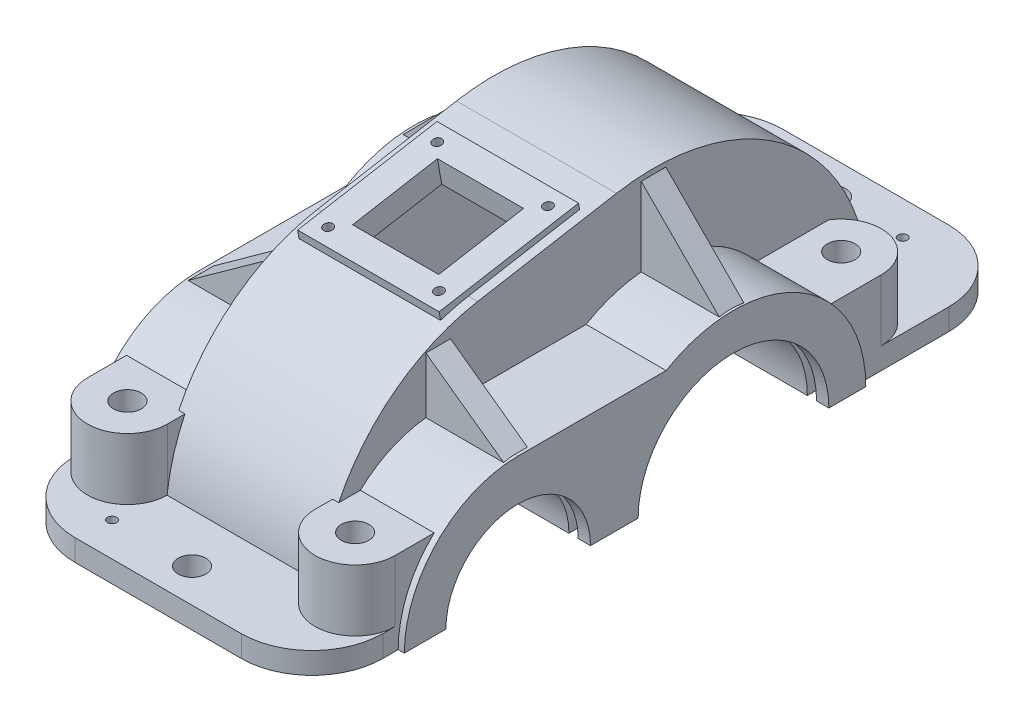
from build123d import *

# Parameters (mm, degrees)
EXTRUDE_1_DEPTH             = 7
EXTRUDE_2_DEPTH             = 52
EXTRUDE_4_DEPTH             = 26
SKETCH_4_R                  = 13
SKETCH_4_W                  = 26
SKETCH_4_H                  = 38
SKETCH_4_H_2                = 45
EXTRUDE_5_DEPTH             = 20
RIB_5_REACH                 = 188.625
SKETCH_5_WALL_W             = 406.05642967
SKETCH_5_WALL_H             = 8
RIB_6_REACH                 = 162.714
SKETCH_6_WALL_W             = 359.136664294
SKETCH_6_WALL_H             = 8
CUT_EXTRUDE_1_REACH         = 143.06
SKETCH_7_R                  = 4.5
CUT_EXTRUDE_2_REACH         = 135.334
SKETCH_8_R                  = 4.5
PATTERN_LINEAR_1_COUNT      = 2
PATTERN_LINEAR_1_PITCH      = 74
PATTERN_LINEAR_1_COUNT_DIR2 = 2
PATTERN_LINEAR_1_PITCH_DIR2 = 158
CUT_EXTRUDE_3_REACH         = 143.06
SKETCH_9_R                  = 1.5
CUT_EXTRUDE_4_REACH         = 143.06
SKETCH_10_R                 = 1.5
SKETCH_11_R                 = 23.5
SKETCH_11_R_2               = 31
CUT_EXTRUDE_5_DEPTH         = 285.5
CUT_EXTRUDE_START           = 48
SKETCH_13_R                 = 27.5
SKETCH_13_R_2               = 35
CUT_EXTRUDE_6_DEPTH         = 3
CUT_EXTRUDE_7_DEPTH         = 20
EXTRUDE_6_DEPTH             = 23
CUT_EXTRUDE_8_REACH         = 154.782
SKETCH_17_W                 = 28
SKETCH_17_H                 = 28
CUT_EXTRUDE_9_REACH         = 154.782
SKETCH_18_R                 = 1.5


with BuildPart() as part:
    # 草图1 → 凸台-拉伸1 (new body)
    with BuildSketch(Plane(origin=(0, 0, 0), x_dir=(1, 0, 0), z_dir=(0, 1, 0))):
        with BuildLine():
            Line((-27, 115), (27, 115))
            ThreePointArc((27, 115), (43.263455967, 108.263455967), (50, 92))
            Line((50, 92), (50, -92))
            ThreePointArc((50, -92), (43.263455967, -108.263455967), (27, -115))
            Line((27, -115), (-27, -115))
            ThreePointArc((-27, -115), (-43.263455967, -108.263455967), (-50, -92))
            Line((-50, -92), (-50, 92))
            ThreePointArc((-50, 92), (-43.263455967, 108.263455967), (-27, 115))
        make_face()
    extrude(amount=EXTRUDE_1_DEPTH)

    # 草图2 → 凸台-拉伸2 (add, symmetric)
    with BuildSketch(Plane(origin=(0, 0, 0), x_dir=(0, 0, -1), z_dir=(1, 0, 0))):
        with BuildLine():
            Line((-1.9089023, 37), (-50, 37))
            ThreePointArc((-50, 37), (-76.162950904, 26.162950904), (-87, 0))
            Line((-87, 0), (63, 0))
            ThreePointArc((63, 0), (41.294567395, 37.356945799), (-1.9089023, 37))
        make_face()
    extrude(amount=EXTRUDE_2_DEPTH, both=True)

    # 草图3 → 凸台-拉伸4 (add, symmetric)
    with BuildSketch(Plane(origin=(0, 0, 0), x_dir=(0, 0, -1), z_dir=(1, 0, 0))):
        with BuildLine():
            Line((7.956989247, 68.956260717), (-37.166666667, 61.075545206))
            ThreePointArc((-37.166666667, 61.075545206), (-71.630787409, 42.511316468), (-88.103571325, 7))
            Line((-88.103571325, 7), (89.649120597, 7))
            ThreePointArc((89.649120597, 7), (62.299651693, 55.774003502), (7.956989247, 68.956260717))
        make_face()
    extrude(amount=EXTRUDE_4_DEPTH, both=True)

    # 草图4 → 凸台-拉伸5 (add)
    with BuildSketch(Plane(origin=(0, 7, 0), x_dir=(1, 0, 0), z_dir=(0, 1, 0))):
        with Locations((37, -88)):
            Circle(SKETCH_4_R)
        with Locations((-37, -88)):
            Circle(SKETCH_4_R)
        with Locations((37, 70)):
            Circle(SKETCH_4_R)
        with Locations((-37, 70)):
            Circle(SKETCH_4_R)
        with Locations((37, -69)):
            Rectangle(SKETCH_4_W, SKETCH_4_H)
        with Locations((-37, -69)):
            Rectangle(SKETCH_4_W, SKETCH_4_H)
        with Locations((37, 47.5)):
            Rectangle(SKETCH_4_W, SKETCH_4_H_2)
        with Locations((-37, 47.5)):
            Rectangle(SKETCH_4_W, SKETCH_4_H_2)
    extrude(amount=EXTRUDE_5_DEPTH)

    # 草图5 wall → 筋5 (add, up to next)
    with BuildSketch(Plane(origin=(38.5, 46, 50), x_dir=(-0.811534341451, 0.584304725845, 0), z_dir=(-0.584304725845, -0.811534341451, 0)), mode=Mode.PRIVATE) as rib_5_sk1:
        Rectangle(SKETCH_5_WALL_W, SKETCH_5_WALL_H)
    rib_5_tool1 = extrude(rib_5_sk1.sketch, amount=RIB_5_REACH, mode=Mode.PRIVATE) - part.part
    rib_5 = rib_5_tool1.solids().sort_by_distance((38.5, 46, 50))[0]
    add(rib_5)

    # 镜向1: 筋5 across plane
    add(rib_5.mirror(Plane(origin=(0, 0, 0), x_dir=(0, 0, 1), z_dir=(1, 0, 0))))

    # 草图6 wall → 筋6 (add, up to next)
    with BuildSketch(Plane(origin=(38.590481041, 55.659219169, -20), x_dir=(-0.705179186997, 0.709029134963, 0), z_dir=(-0.709029134963, -0.705179186997, 0)), mode=Mode.PRIVATE) as rib_6_sk1:
        Rectangle(SKETCH_6_WALL_W, SKETCH_6_WALL_H)
    rib_6_tool1 = extrude(rib_6_sk1.sketch, amount=RIB_6_REACH, mode=Mode.PRIVATE) - part.part
    rib_6 = rib_6_tool1.solids().sort_by_distance((38.590481041, 55.659219169, -20))[0]
    add(rib_6)

    # 镜向2: 筋6 across plane
    add(rib_6.mirror(Plane(origin=(0, 0, 0), x_dir=(0, 0, 1), z_dir=(1, 0, 0))))

    # 草图7 → 切除-拉伸1 (cut, up to next)
    with BuildSketch(Plane(origin=(0, 7, 0), x_dir=(1, 0, 0), z_dir=(0, 1, 0)), mode=Mode.PRIVATE) as cut_extrude_1_sk1:
        with Locations((0, 104)):
            Circle(SKETCH_7_R)
    cut_extrude_1_tool1 = extrude(cut_extrude_1_sk1.sketch, amount=-CUT_EXTRUDE_1_REACH, mode=Mode.PRIVATE) & part.part
    # 草图7 → 切除-拉伸1 (cut, up to next)
    with BuildSketch(Plane(origin=(0, 7, 0), x_dir=(1, 0, 0), z_dir=(0, 1, 0)), mode=Mode.PRIVATE) as cut_extrude_1_sk2:
        with Locations((0, -104)):
            Circle(SKETCH_7_R)
    cut_extrude_1_tool2 = extrude(cut_extrude_1_sk2.sketch, amount=-CUT_EXTRUDE_1_REACH, mode=Mode.PRIVATE) & part.part
    add(cut_extrude_1_tool1.solids().sort_by_distance((0, 7, -104))[0], mode=Mode.SUBTRACT)
    add(cut_extrude_1_tool2.solids().sort_by_distance((0, 7, 104))[0], mode=Mode.SUBTRACT)

    # 草图8 → 切除-拉伸2 (cut, up to next)
    with BuildSketch(Plane(origin=(0, 27, 0), x_dir=(1, 0, 0), z_dir=(0, 1, 0)), mode=Mode.PRIVATE) as cut_extrude_2_sk1:
        with Locations((-37, 70)):
            Circle(SKETCH_8_R)
    cut_extrude_2_tool1 = extrude(cut_extrude_2_sk1.sketch, amount=-CUT_EXTRUDE_2_REACH, mode=Mode.PRIVATE) & part.part
    cut_extrude_2 = cut_extrude_2_tool1.solids().sort_by_distance((-37, 27, -70))[0]
    add(cut_extrude_2, mode=Mode.SUBTRACT)

    # 阵列(线性)1: Cut-Extrude 2 2 × 2
    with Locations(*[(i * PATTERN_LINEAR_1_PITCH, 0, j * PATTERN_LINEAR_1_PITCH_DIR2) for i in range(PATTERN_LINEAR_1_COUNT) for j in range(PATTERN_LINEAR_1_COUNT_DIR2) if (i, j) != (0, 0)]):
        add(cut_extrude_2, mode=Mode.SUBTRACT)

    # 草图9 → 切除-拉伸3 (cut, up to next)
    with BuildSketch(Plane(origin=(0, 7, 0), x_dir=(1, 0, 0), z_dir=(0, 1, 0)), mode=Mode.PRIVATE) as cut_extrude_3_sk1:
        with Locations((-26, -104)):
            Circle(SKETCH_9_R)
    cut_extrude_3_tool1 = extrude(cut_extrude_3_sk1.sketch, amount=-CUT_EXTRUDE_3_REACH, mode=Mode.PRIVATE) & part.part
    add(cut_extrude_3_tool1.solids().sort_by_distance((-26, 7, 104))[0], mode=Mode.SUBTRACT)

    # 草图10 → 切除-拉伸4 (cut, up to next)
    with BuildSketch(Plane(origin=(0, 7, 0), x_dir=(1, 0, 0), z_dir=(0, 1, 0)), mode=Mode.PRIVATE) as cut_extrude_4_sk1:
        with Locations((23, 104)):
            Circle(SKETCH_10_R)
    cut_extrude_4_tool1 = extrude(cut_extrude_4_sk1.sketch, amount=-CUT_EXTRUDE_4_REACH, mode=Mode.PRIVATE) & part.part
    add(cut_extrude_4_tool1.solids().sort_by_distance((23, 7, -104))[0], mode=Mode.SUBTRACT)

    # 草图11 → 切除-拉伸5 (cut, symmetric)
    with BuildSketch(Plane(origin=(0, 0, 0), x_dir=(0, 0, -1), z_dir=(1, 0, 0))):
        with Locations((-50, 0)):
            Circle(SKETCH_11_R)
        with Locations((20, 0)):
            Circle(SKETCH_11_R_2)
    extrude(amount=CUT_EXTRUDE_5_DEPTH, both=True, mode=Mode.SUBTRACT)

    # 草图13 → 切除-拉伸6 (cut)
    with BuildSketch(Plane(origin=(0, 0, 0), x_dir=(0, 0, -1), z_dir=(1, 0, 0)).offset(CUT_EXTRUDE_START)):
        with Locations((-50, 0)):
            Circle(SKETCH_13_R)
        with Locations((20, 0)):
            Circle(SKETCH_13_R_2)
    cut_extrude_6 = extrude(amount=-CUT_EXTRUDE_6_DEPTH, mode=Mode.SUBTRACT)

    # 镜向3: 切除-拉伸6 across plane
    add(cut_extrude_6.mirror(Plane(origin=(0, 0, 0), x_dir=(0, 0, 1), z_dir=(1, 0, 0))), mode=Mode.SUBTRACT)

    # 草图15 → 切除-拉伸7 (cut, symmetric)
    with BuildSketch(Plane(origin=(0, 0, 0), x_dir=(0, 0, -1), z_dir=(1, 0, 0))):
        with BuildLine():
            Line((-82.5, 0), (84, 0))
            ThreePointArc((84, 0), (61.178342778, 48.993306543), (8.989247312, 63.045724084))
            Line((8.989247312, 63.045724084), (-36.134408602, 55.165008573))
            ThreePointArc((-36.134408602, 55.165008573), (-69.369143225, 36.031049931), (-82.5, 0))
        make_face()
    extrude(amount=CUT_EXTRUDE_7_DEPTH, both=True, mode=Mode.SUBTRACT)

    # 草图16 → 凸台-拉伸6 (add, symmetric)
    with BuildSketch(Plane(origin=(0, 0, 0), x_dir=(0, 0, -1), z_dir=(1, 0, 0))):
        Polygon((-46.682604529, 61.443886786), (-45.822389476, 56.518439592), (-0.508275291, 64.432418086), (-1.368490344, 69.35786528), align=None)
    extrude(amount=EXTRUDE_6_DEPTH, both=True)

    # 草图17 → 切除-拉伸8 (cut, up to next)
    with BuildSketch(Plane(origin=(0, 67.536884536, 11.795120823), x_dir=(1, 0, 0), z_dir=(0, 0.9850894388080457, 0.17204301075268907)), mode=Mode.PRIVATE) as cut_extrude_8_sk1:
        with Locations((0, -12.415549423)):
            Rectangle(SKETCH_17_W, SKETCH_17_H)
    cut_extrude_8_tool1 = extrude(cut_extrude_8_sk1.sketch, amount=-CUT_EXTRUDE_8_REACH, mode=Mode.PRIVATE) & part.part
    add(cut_extrude_8_tool1.solids().sort_by_distance((0, 65.400876, 24.025547))[0], mode=Mode.SUBTRACT)

    # 草图18 → 切除-拉伸9 (cut, up to next)
    with BuildSketch(Plane(origin=(0, 67.536884536, 11.795120823), x_dir=(1, 0, 0), z_dir=(0, 0.9850894388080457, 0.17204301075268907)), mode=Mode.PRIVATE) as cut_extrude_9_sk1:
        with Locations((-18, -30.415549423)):
            Circle(SKETCH_18_R)
    cut_extrude_9_tool1 = extrude(cut_extrude_9_sk1.sketch, amount=-CUT_EXTRUDE_9_REACH, mode=Mode.PRIVATE) & part.part
    # 草图18 → 切除-拉伸9 (cut, up to next)
    with BuildSketch(Plane(origin=(0, 67.536884536, 11.795120823), x_dir=(1, 0, 0), z_dir=(0, 0.9850894388080457, 0.17204301075268907)), mode=Mode.PRIVATE) as cut_extrude_9_sk2:
        with Locations((18, -30.415549423)):
            Circle(SKETCH_18_R)
    cut_extrude_9_tool2 = extrude(cut_extrude_9_sk2.sketch, amount=-CUT_EXTRUDE_9_REACH, mode=Mode.PRIVATE) & part.part
    # 草图18 → 切除-拉伸9 (cut, up to next)
    with BuildSketch(Plane(origin=(0, 67.536884536, 11.795120823), x_dir=(1, 0, 0), z_dir=(0, 0.9850894388080457, 0.17204301075268907)), mode=Mode.PRIVATE) as cut_extrude_9_sk3:
        with Locations((-18, 5.584450577)):
            Circle(SKETCH_18_R)
    cut_extrude_9_tool3 = extrude(cut_extrude_9_sk3.sketch, amount=-CUT_EXTRUDE_9_REACH, mode=Mode.PRIVATE) & part.part
    # 草图18 → 切除-拉伸9 (cut, up to next)
    with BuildSketch(Plane(origin=(0, 67.536884536, 11.795120823), x_dir=(1, 0, 0), z_dir=(0, 0.9850894388080457, 0.17204301075268907)), mode=Mode.PRIVATE) as cut_extrude_9_sk4:
        with Locations((18, 5.584450577)):
            Circle(SKETCH_18_R)
    cut_extrude_9_tool4 = extrude(cut_extrude_9_sk4.sketch, amount=-CUT_EXTRUDE_9_REACH, mode=Mode.PRIVATE) & part.part
    add(cut_extrude_9_tool1.solids().sort_by_distance((-18, 62.304102, 41.757157))[0], mode=Mode.SUBTRACT)
    add(cut_extrude_9_tool2.solids().sort_by_distance((18, 62.304102, 41.757157))[0], mode=Mode.SUBTRACT)
    add(cut_extrude_9_tool3.solids().sort_by_distance((-18, 68.49765, 6.293938))[0], mode=Mode.SUBTRACT)
    add(cut_extrude_9_tool4.solids().sort_by_distance((18, 68.49765, 6.293938))[0], mode=Mode.SUBTRACT)


solid = part.part
